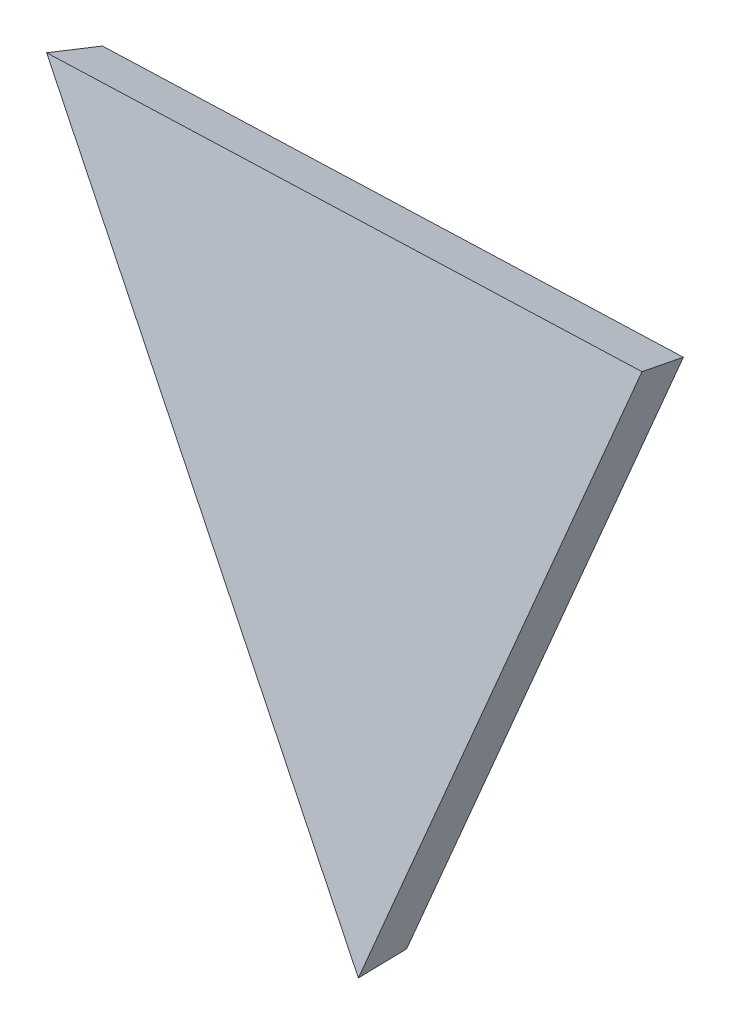
from build123d import *

# Parameters (mm, degrees)
BOSS_EXTRUDE1_DEPTH = 70
CHAMFER1_SIZE2      = 4.18941816
CHAMFER1_SIZE       = 70
CHAMFER2_SIZE       = 7.017777763
CHAMFER2_SIZE_2     = 70


# Some blends are built 0.0001 mm under size
with BuildPart() as part:
    # Sketch1 → Boss-Extrude1 (new body)
    with BuildSketch(Plane(origin=(5.473822054, -457.937984789, -3307.31325441), x_dir=(-0.9856470342360776, 0.16521656475401902, -0.03469020946183102), z_dir=(-0.0017423663357502073, 0.19552071957465159, 0.980698023030822))):
        Polygon((1127.410622311, 6899.993028511), (1231.788289667, 7721.098906243), (1938.364522736, 7065.713670786), align=None)
    extrude(amount=-BOSS_EXTRUDE1_DEPTH)

    # Chamfer1
    chamfer1_edges = [part.edges().sort_by_distance(p)[0] for p in [
        (-2804.812562525, -7356.820333598, -2008.261086677),
    ]]
    chamfer1_side = [part.faces().sort_by_distance(p)[0] for p in [
        (-2804.812708515, -7356.803951237, -2008.178915595),
    ]]
    chamfer(chamfer1_edges, length=CHAMFER1_SIZE - 0.0001, length2=CHAMFER1_SIZE2 - 0.0001, reference=chamfer1_side[0])  # a hair under: the kernel refuses the full size

    # Chamfer2
    # the kernel refuses this chamfer: 70, 7.017777763 mm, written as the material it takes off along each edge
    with BuildSketch(Plane(origin=(-3274.435511319, -6987.276794808, -2082.770948142), x_dir=(0.030469156507814454, -0.9854547133895118, -0.1671844441331112), z_dir=(0.999487976226041, 0.031673079457915976, -0.004538878410539619))) as chamfer2_piece_1:
        Polygon((CHAMFER2_SIZE * 0.934223811245, -CHAMFER2_SIZE * 0.356687356966), (-CHAMFER2_SIZE_2 * 0.356687356946, -CHAMFER2_SIZE_2 * 0.93422381119), (0, 0), align=None)
    extrude(amount=1186.493835622, mode=Mode.SUBTRACT)
    with BuildSketch(Plane(origin=(-2217.332595505, -6784.751941859, -2121.270000408), x_dir=(0.0019280825655142314, 0.19442255260126845, 0.9809159767980269), z_dir=(-0.2917562783292002, -0.9381311781639606, 0.1865158615565802))) as chamfer2_piece_2:
        Polygon((CHAMFER2_SIZE_2 * 0.999992637165, CHAMFER2_SIZE_2 * 0.00383739696559), (-CHAMFER2_SIZE * 0.00383739696579, CHAMFER2_SIZE * 0.999992637223), (0, 0), align=None)
    extrude(amount=1186.493835622, mode=Mode.SUBTRACT)


solid = part.part
